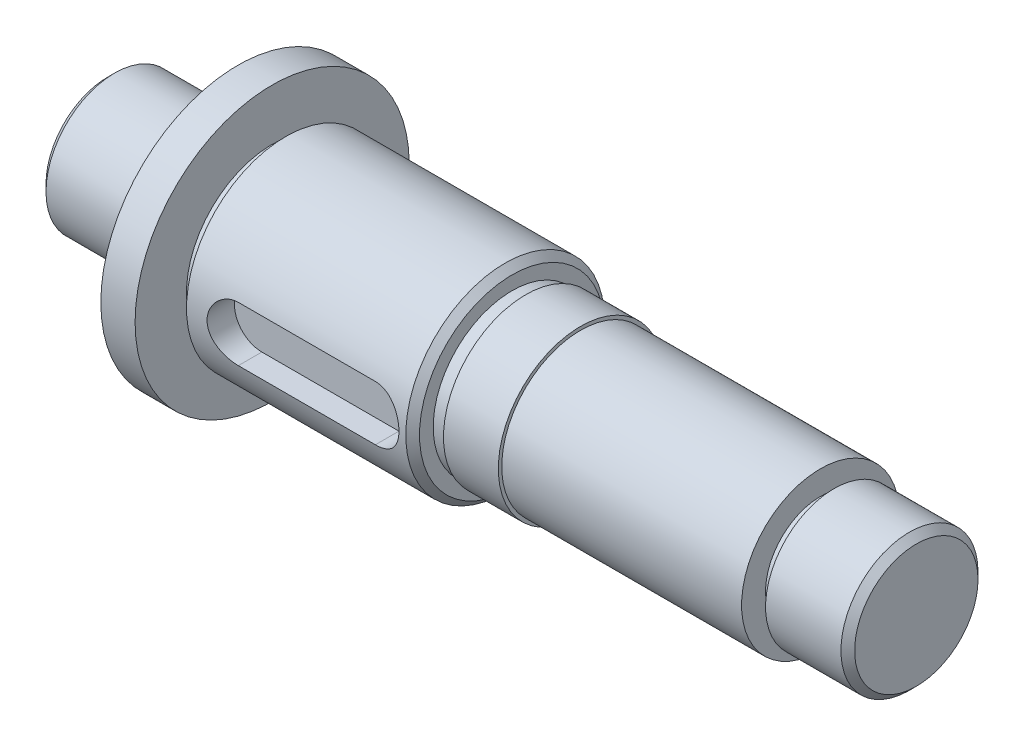
from build123d import *

# Parameters (mm, degrees)
CHAMFER_1_SIZE      = 1
SKETCH_2_W          = 5.515970317
SKETCH_2_H          = 8
CUT_EXTRUDE_1_DEPTH = 28
FILLET_1_R          = 4
FILLET_2_R          = 4


with BuildPart() as part:
    # 草图1 → 旋转1 (revolve)
    with BuildSketch(Plane.XY, mode=Mode.PRIVATE) as revolve_1_sk:
        Polygon((0, 0), (0, 10), (12, 10), (12, 8), (14, 8), (14, 12.5), (19, 12.5), (19, 20), (24, 20), (24, 12.5), (26, 12.5), (26, 14.5), (59, 14.5), (59, 11.5), (61, 11.5), (61, 12), (69, 12), (69, 11.5), (104, 11.5), (104, 8), (106, 8), (106, 10), (118, 10), (118, 0), align=None)
    revolve(revolve_1_sk.sketch.rotate(Axis((0, 0, 0), (-1, 0, 0)), 90), axis=Axis((0, 0, 0), (-1, 0, 0)))

    # 倒角1
    chamfer_1_edges = [part.edges().sort_by_distance(p)[0] for p in [
        (118, 0, 10),
        (59, 0, 14.5),
        (0, 0, 10),
    ]]
    chamfer(chamfer_1_edges, length=CHAMFER_1_SIZE)

    # 草图2 → 切除-拉伸1 (cut)
    with BuildSketch(Plane(origin=(29, 0, 0), x_dir=(0, 0, -1), z_dir=(1, 0, 0))):
        with Locations((-13.257985159, 0)):
            Rectangle(SKETCH_2_W, SKETCH_2_H)
    extrude(amount=CUT_EXTRUDE_1_DEPTH, mode=Mode.SUBTRACT)

    # 圆角1
    fillet_1_edges = [part.edges().sort_by_distance(p)[0] for p in [
        (29, 4, 12.218679932),
        (29, -4, 12.218679932),
    ]]
    fillet(fillet_1_edges, radius=FILLET_1_R - 0.0001)  # a hair under: the kernel refuses the full size

    # 圆角2
    fillet_2_edges = [part.edges().sort_by_distance(p)[0] for p in [
        (57, -4, 12.218679932),
        (57, 4, 12.218679932),
    ]]
    fillet(fillet_2_edges, radius=FILLET_2_R - 0.0001)  # a hair under: the kernel refuses the full size


solid = part.part
